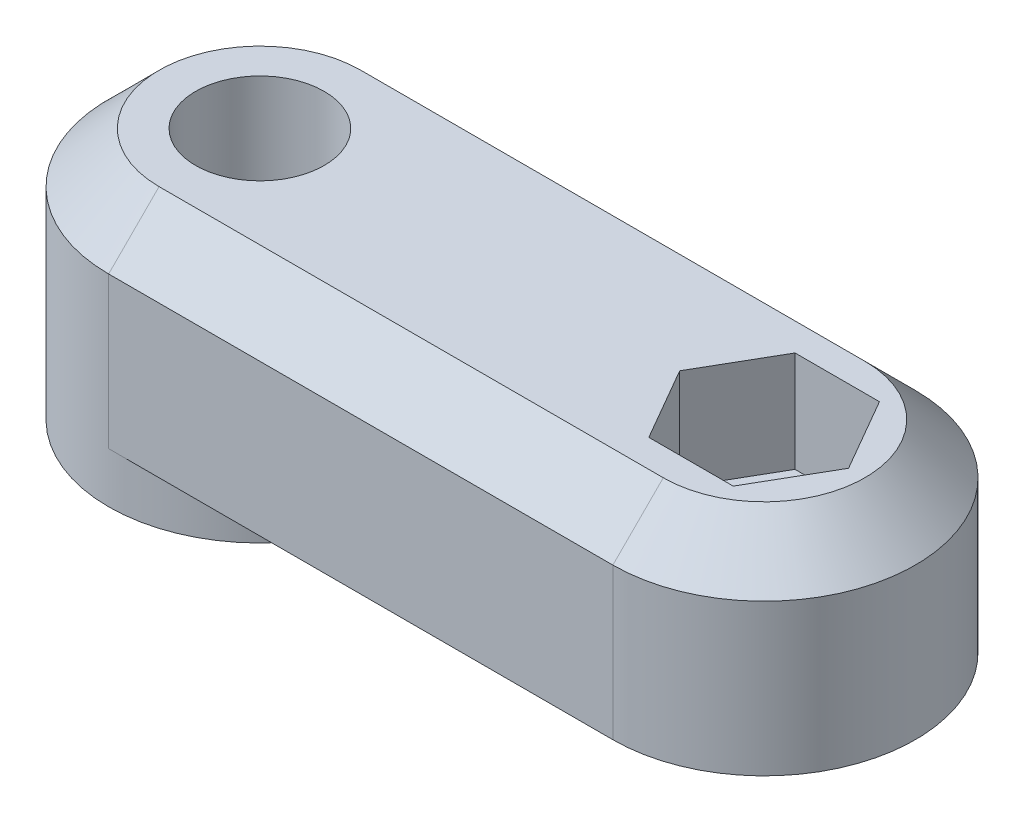
from build123d import *

# Parameters (mm, degrees)
BOSS_EXTRUDE1_DEPTH = 10
CHAMFER1_SIZE       = 2
CUT_EXTRUDE1_DEPTH  = 5
SKETCH5_R           = 34.202431596
SKETCH5_R_2         = 6
CUT_EXTRUDE2_DEPTH  = 2
CUT_EXTRUDE3_DEPTH  = 4


with BuildPart() as part:
    # Sketch1 → Boss-Extrude1 (new body)
    with BuildSketch(Plane(origin=(0, 0, 0), x_dir=(1, 0, 0), z_dir=(0, 1, 0))):
        with BuildLine():
            Line((0, 6), (20, 6))
            ThreePointArc((20, 6), (26, 0), (20, -6))
            Line((20, -6), (0, -6))
            ThreePointArc((0, -6), (-6, 0), (0, 6))
        make_face()
    extrude(amount=BOSS_EXTRUDE1_DEPTH)

    # Sketch2 → Cut-Revolve1 (revolve, cut)
    with BuildSketch(Plane.XY):
        Polygon((0, 10), (-2.55, 10), (-2.55, 5), (-2.1, 5), (-2.1, 2), (-2.55, 2), (-2.55, 0), (0, 0), align=None)
    revolve(axis=Axis((0, 0, 0), (0, 1, 0)), mode=Mode.SUBTRACT)

    # Sketch3 → Cut-Revolve2 (revolve, cut)
    with BuildSketch(Plane.XY):
        Polygon((20, 10), (17.5, 10), (17.5, 6), (17.925, 6), (17.925, 0), (20, 0), align=None)
    revolve(axis=Axis((20, 0, 0), (0, 1, 0)), mode=Mode.SUBTRACT)

    # Chamfer1
    chamfer1_edges = [part.edges().sort_by_distance(p)[0] for p in [
        (10, 10, 6),
        (26, 10, 0),
        (-6, 10, 0),
        (10, 10, -6),
    ]]
    chamfer(chamfer1_edges, length=CHAMFER1_SIZE)

    # Sketch4 → Cut-Extrude1 (cut)
    with BuildSketch(Plane.XZ):
        Polygon((2.107328483, 3.65), (-2.107328483, 3.65), (-4.214656965, 0), (-2.107328483, -3.65), (2.107328483, -3.65), (4.214656965, 0), align=None)
    extrude(amount=-CUT_EXTRUDE1_DEPTH, mode=Mode.SUBTRACT)

    # Sketch5 → Cut-Extrude2 (cut)
    with BuildSketch(Plane.XZ):
        Circle(SKETCH5_R)
        Circle(SKETCH5_R_2, mode=Mode.SUBTRACT)
    extrude(amount=-CUT_EXTRUDE2_DEPTH, mode=Mode.SUBTRACT)

    # Sketch6 → Cut-Extrude3 (cut)
    with BuildSketch(Plane(origin=(0, 10, 0), x_dir=(1, 0, 0), z_dir=(0, 1, 0))):
        Polygon((21.674315781, -2.9), (23.348631561, 0), (21.674315781, 2.9), (18.325684219, 2.9), (16.651368439, 0), (18.325684219, -2.9), align=None)
    extrude(amount=-CUT_EXTRUDE3_DEPTH, mode=Mode.SUBTRACT)


solid = part.part
